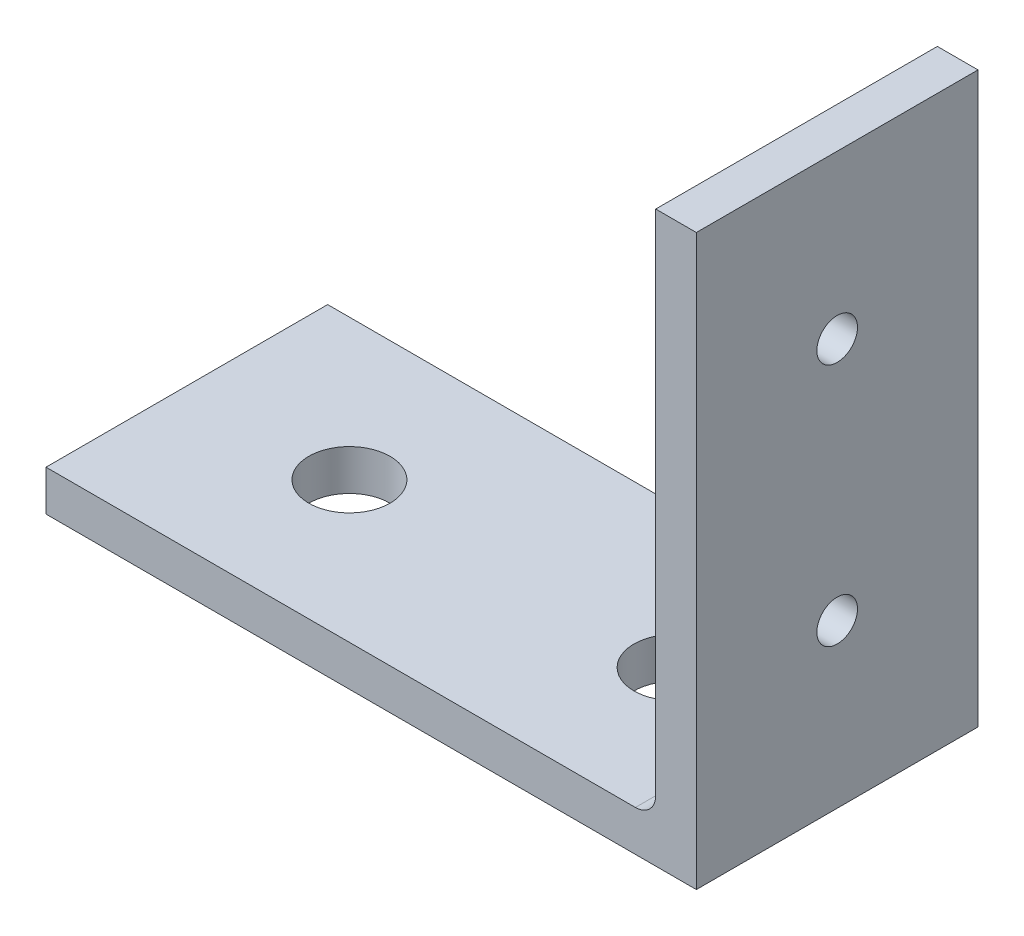
from build123d import *

# Parameters (mm, degrees)
BOSS_EXTRUDE1_DEPTH = 11
FILLET1_R           = 1.5875
SKETCH3_W           = 24.423912887
SKETCH3_H           = 26.552361768
CUT_EXTRUDE1_DEPTH  = 61.908127536
SKETCH4_R           = 3.175
CUT_EXTRUDE2_DEPTH  = 53.363751775
SKETCH5_R           = 1.5875
CUT_EXTRUDE3_DEPTH  = 69.391830652


with BuildPart() as part:
    # Sketch2 → Boss-Extrude1 (new, symmetric)
    with BuildSketch(Plane.XY):
        Polygon((-25.4, 0), (25.4, 0), (25.4, 50.8), (22.225, 50.8), (22.225, 3.175), (-25.4, 3.175), align=None)
    extrude(amount=BOSS_EXTRUDE1_DEPTH, both=True)

    # Fillet1
    fillet1_edges = [part.edges().sort_by_distance(p)[0] for p in [
        (22.225, 3.175, 0),
    ]]
    fillet(fillet1_edges, radius=FILLET1_R)

    # Sketch3 → Cut-Extrude1 (cut, through all)
    with BuildSketch(Plane.XY.offset(11)):
        with Locations((18.271034128, 57.726180884)):
            Rectangle(SKETCH3_W, SKETCH3_H)
    extrude(amount=-CUT_EXTRUDE1_DEPTH, mode=Mode.SUBTRACT)

    # Sketch4 → Cut-Extrude2 (cut, through all)
    with BuildSketch(Plane.XZ):
        with Locations((-12.7, 0)):
            Circle(SKETCH4_R)
        with Locations((12.7, 0)):
            Circle(SKETCH4_R)
    extrude(amount=-CUT_EXTRUDE2_DEPTH, mode=Mode.SUBTRACT)

    # Sketch5 → Cut-Extrude3 (cut, through all)
    with BuildSketch(Plane(origin=(25.4, 0, 0), x_dir=(0, 0, -1), z_dir=(1, 0, 0))):
        with Locations((0, 31.75)):
            Circle(SKETCH5_R)
        with Locations((0, 12.7)):
            Circle(SKETCH5_R)
    extrude(amount=-CUT_EXTRUDE3_DEPTH, mode=Mode.SUBTRACT)


solid = part.part
